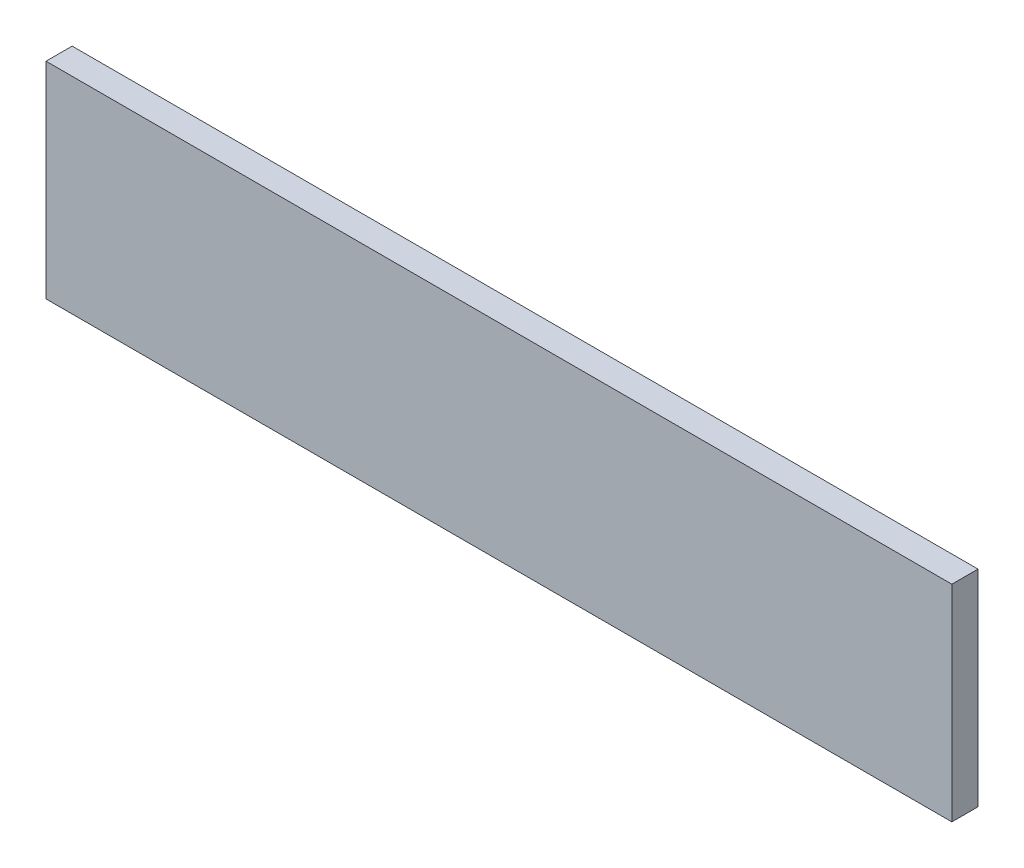
from build123d import *

# Parameters (mm, degrees)
SKETCH1_W           = 220
SKETCH1_H           = 50
BOSS_EXTRUDE1_DEPTH = 3.175


with BuildPart() as part:
    # Sketch1 → Boss-Extrude1 (new, symmetric)
    with BuildSketch(Plane.XY):
        Rectangle(SKETCH1_W, SKETCH1_H)
    extrude(amount=BOSS_EXTRUDE1_DEPTH, both=True)


solid = part.part
